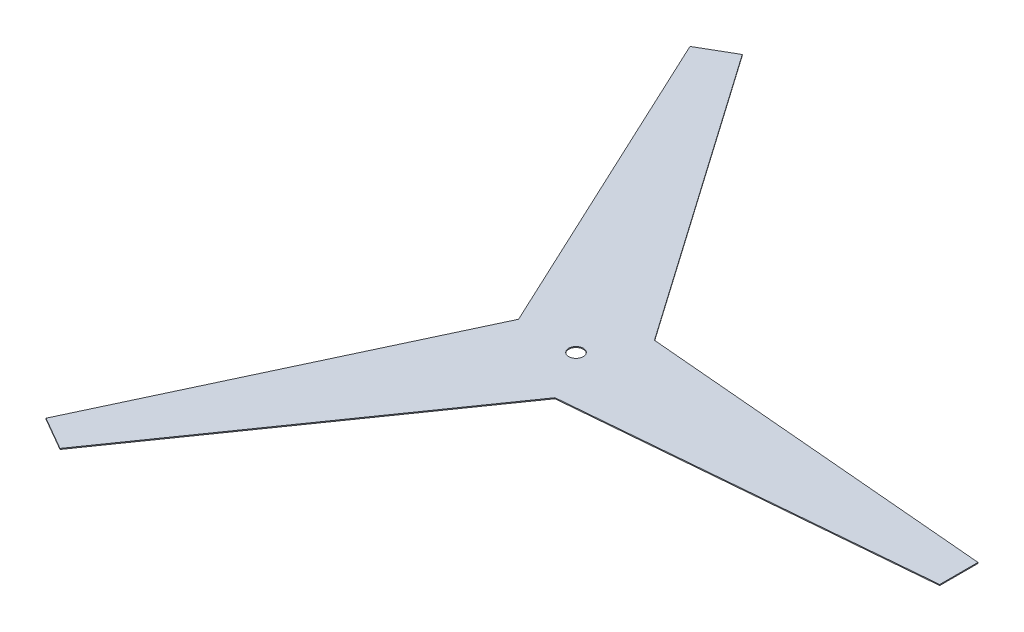
from build123d import *

# Parameters (mm, degrees)
SALIENTE_EXTRUIR3_DEPTH = 2.5


with BuildPart() as part:
    # Croquis1 → Saliente-Extruir3 (new body)
    with BuildSketch(Plane(origin=(0, 0, 0), x_dir=(1, 0, 0), z_dir=(0, 1, 0))):
        Polygon((-543.301270189, -841.025403784), (-456.698729811, -891.025403784), (75, -129.903810568), (1000, -50), (1000, 50), (75, 129.903810568), (-456.698729811, 891.025403784), (-543.301270189, 841.025403784), (-150, 0), align=None)
        with BuildLine():
            ThreePointArc((-16.497783942, 9.525), (-9.525, 16.497783942), (0, 19.05))
            ThreePointArc((0, 19.05), (9.525, 16.497783942), (16.497783942, 9.525))
            ThreePointArc((16.497783942, 9.525), (18.400886991, 4.930502809), (19.05, 0))
            ThreePointArc((19.05, 0), (18.400886991, -4.930502809), (16.497783942, -9.525))
            ThreePointArc((16.497783942, -9.525), (9.525, -16.497783942), (0, -19.05))
            ThreePointArc((0, -19.05), (-9.525, -16.497783942), (-16.497783942, -9.525))
            ThreePointArc((-16.497783942, -9.525), (-19.05, 0), (-16.497783942, 9.525))
        make_face(mode=Mode.SUBTRACT)
    extrude(amount=SALIENTE_EXTRUIR3_DEPTH)


solid = part.part
